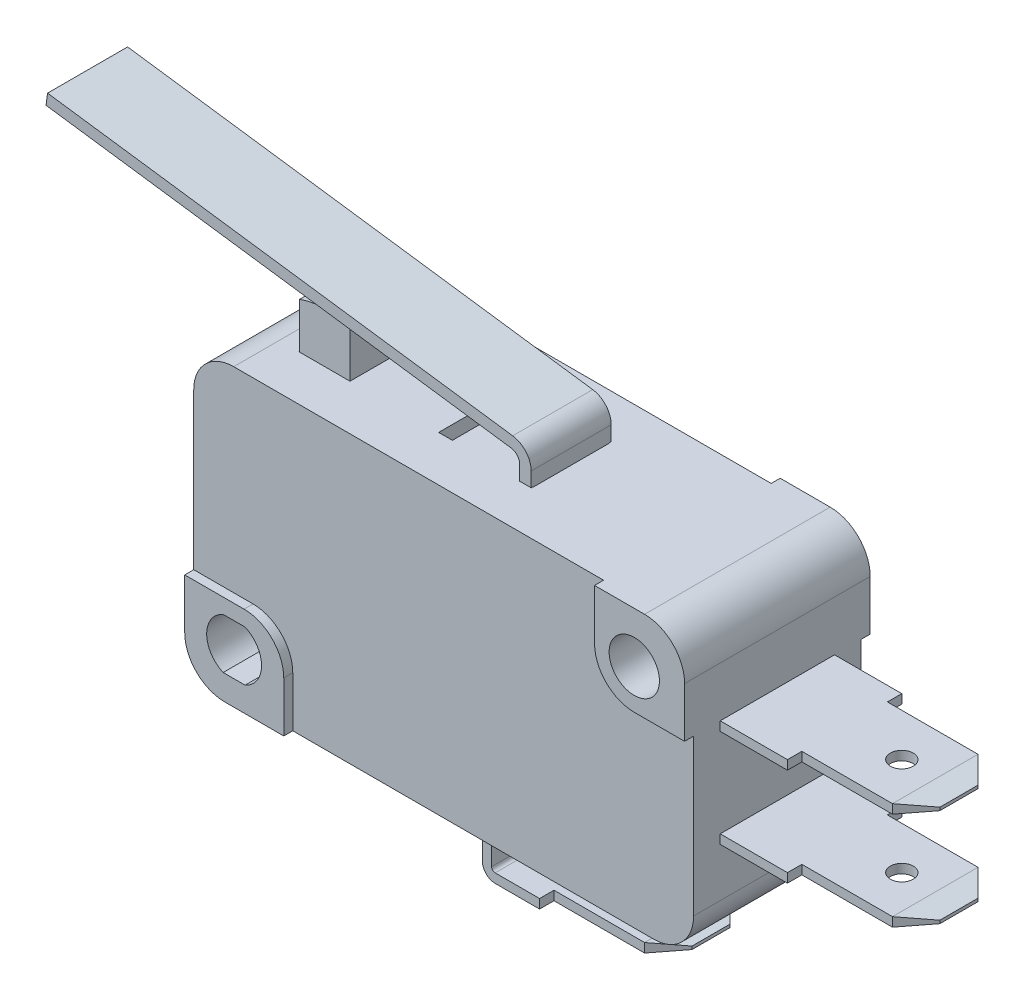
from build123d import *

# Parameters (mm, degrees)
SKETCH1_W               = 27.7622
SKETCH1_H               = 15.875
SKETCH1_R               = 1.397
EXTRUDE1_DEPTH          = 5.155
FILLET1_R               = 2.2225
EXTRUDE2_DEPTH          = 2.1
SKETCH3_W               = 2.8508
SKETCH3_H               = 4.2508
SKETCH3_W_2             = 0.762
CUT_EXTRUDE1_DEPTH      = 2
CUT_EXTRUDE2_DEPTH      = 0.5
EXTRUDE3_DEPTH          = 3.175
SKETCH6_R               = 0.635
CUT_EXTRUDE3_DEPTH      = 26.970827061
EXTRUDE4_START          = -5.0038
SKETCH8_R               = 0.635
EXTRUDE4_DEPTH          = 0.508
LPATTERN1_COUNT         = 2
LPATTERN1_PITCH         = 5.4356
CUT_EXTRUDE4_DEPTH      = 27.924770629
CUT_EXTRUDE4_DEPTH_BACK = 27.924770629
LEVER2A_START           = -2.2225
LEVER2A_DEPTH           = 4.445


# Read off the part's stored shape, not the designer's step: Lever2a
with BuildPart() as part:
    # Sketch1 → Extrude1 (new, symmetric)
    with BuildSketch(Plane.XY):
        Rectangle(SKETCH1_W, SKETCH1_H)
        with Locations((11.0871, 5.1435)):
            Circle(SKETCH1_R, mode=Mode.SUBTRACT)
        with BuildLine():
            Line((-11.746970603, -3.7719), (-10.528829397, -3.7719))
            ThreePointArc((-10.528829397, -3.7719), (-9.6139, -5.1689), (-10.528829397, -6.5659))
            Line((-10.528829397, -6.5659), (-11.746970603, -6.5659))
            ThreePointArc((-11.746970603, -6.5659), (-12.6619, -5.1689), (-11.746970603, -3.7719))
        make_face(mode=Mode.SUBTRACT)
    extrude(amount=EXTRUDE1_DEPTH, both=True)

    # Fillet1
    fillet1_edges = [part.edges().sort_by_distance(p)[0] for p in [
        (-13.8811, 7.9375, 0),
        (13.8811, 7.9375, 0),
        (13.8811, -7.9375, 0),
        (-13.8811, -7.9375, 0),
    ]]
    fillet(fillet1_edges, radius=FILLET1_R)

    # Sketch3 → Cut-Extrude1 (cut)
    with BuildSketch(Plane(origin=(0, 7.9375, 0), x_dir=(-1, 0, 0), z_dir=(0, 1, 0))):
        with Locations((9.1567, 0)):
            Rectangle(SKETCH3_W, SKETCH3_H)
        with Locations((2.4257, 0)):
            Rectangle(SKETCH3_W_2, SKETCH3_H)
        with Locations((-2.0701, 0)):
            Rectangle(SKETCH3_W_2, SKETCH3_H)
    extrude(amount=-CUT_EXTRUDE1_DEPTH, mode=Mode.SUBTRACT)

    # Sketch4 → Cut-Extrude2 (cut)
    with BuildSketch(Plane.XY.offset(5.155)):
        with BuildLine():
            Line((-8.3811, -7.9375), (13.8811, -7.9375))
            Line((13.8811, -7.9375), (13.8811, 2.9375))
            Line((13.8811, 2.9375), (11.0871, 2.9375))
            ThreePointArc((11.0871, 2.9375), (9.527222441, 3.583622441), (8.8811, 5.1435))
            Line((8.8811, 5.1435), (8.8811, 7.9375))
            Line((8.8811, 7.9375), (-13.8811, 7.9375))
            Line((-13.8811, 7.9375), (-13.8811, -2.9375))
            Line((-13.8811, -2.9375), (-10.5871, -2.9375))
            ThreePointArc((-10.5871, -2.9375), (-9.027222441, -3.583622441), (-8.3811, -5.1435))
            Line((-8.3811, -5.1435), (-8.3811, -7.9375))
        make_face()
    cut_extrude2 = extrude(amount=-CUT_EXTRUDE2_DEPTH, mode=Mode.SUBTRACT)

    # Mirror1: Cut-Extrude2 across plane
    add(cut_extrude2.mirror(Plane.XY), mode=Mode.SUBTRACT)

    # Sketch5 → Extrude3 (add, symmetric)
    with BuildSketch(Plane.XY):
        with BuildLine():
            Line((0.6731, -7.9375), (0.6731, -10.4299))
            ThreePointArc((0.6731, -10.4299), (0.880468399, -10.930531601), (1.3811, -11.1379))
            Line((1.3811, -11.1379), (10.1981, -11.1379))
            Line((10.1981, -11.1379), (10.1981, -10.6299))
            Line((10.1981, -10.6299), (1.3811, -10.6299))
            ThreePointArc((1.3811, -10.6299), (1.239678644, -10.571321356), (1.1811, -10.4299))
            Line((1.1811, -10.4299), (1.1811, -7.9375))
            Line((1.1811, -7.9375), (0.6731, -7.9375))
        make_face()
    extrude(amount=EXTRUDE3_DEPTH, both=True)

    # Sketch6 → Cut-Extrude3 (cut, through all)
    with BuildSketch(Plane(origin=(0, -10.6299, 0), x_dir=(-1, 0, 0), z_dir=(0, 1, 0))):
        with Locations((-7.0231, 0)):
            Circle(SKETCH6_R)
        Polygon((-10.1981, 1.058333333), (-8.881533333, 2.3749), (-3.8481, 2.3749), (-3.8481, 3.175), (-10.1981, 3.175), align=None)
        Polygon((-10.1981, -3.175), (-10.1981, -1.058333333), (-8.881533333, -2.3749), (-3.8481, -2.3749), (-3.8481, -3.175), align=None)
    extrude(amount=-CUT_EXTRUDE3_DEPTH, mode=Mode.SUBTRACT)

    # Sketch8 → Extrude4 (add)
    with BuildSketch(Plane(origin=(0, 7.9375, 0), x_dir=(-1, 0, 0), z_dir=(0, 1, 0)).offset(EXTRUDE4_START)):
        Polygon((-13.8811, -3.175), (-17.6149, -3.175), (-17.6149, -2.3749), (-22.648333333, -2.3749), (-23.9649, -1.058333333), (-23.9649, 1.058333333), (-22.648333333, 2.3749), (-17.6149, 2.3749), (-17.6149, 3.175), (-13.8811, 3.175), align=None)
        with Locations((-20.7899, 0)):
            Circle(SKETCH8_R, mode=Mode.SUBTRACT)
    extrude4 = extrude(amount=-EXTRUDE4_DEPTH)

    # LPattern1: Extrude4 ×2
    with Locations(*[(0, -i * LPATTERN1_PITCH, 0) for i in range(1, LPATTERN1_COUNT)]):
        add(extrude4)

    # Sketch7 → Cut-Extrude4 (cut, two sides: drawn at the far end of the back side and taken through both)
    with BuildSketch(Plane.XY.offset(-CUT_EXTRUDE4_DEPTH_BACK)):
        Polygon((8.881533333, -10.6299), (10.1981, -10.6299), (10.1981, -10.799233333), align=None)
        Polygon((8.881533333, -11.1379), (10.1981, -11.1379), (10.1981, -10.968566667), align=None)
        Polygon((22.648333333, 2.9337), (23.9649, 2.764366667), (23.9649, 2.9337), align=None)
        Polygon((23.9649, 2.595033333), (22.648333333, 2.4257), (23.9649, 2.4257), align=None)
        Polygon((22.648333333, -2.5019), (23.9649, -2.5019), (23.9649, -2.671233333), align=None)
        Polygon((23.9649, -2.840566667), (22.648333333, -3.0099), (23.9649, -3.0099), align=None)
    extrude(amount=CUT_EXTRUDE4_DEPTH + CUT_EXTRUDE4_DEPTH_BACK, mode=Mode.SUBTRACT)


with BuildPart() as body_2:
    # Sketch2 → Extrude2 (new, symmetric)
    with BuildSketch(Plane.XY):
        with BuildLine():
            Line((-10.5567, 7.278098799), (-10.5567, 10.453098799))
            ThreePointArc((-10.5567, 10.453098799), (-9.1567, 10.7061), (-7.7567, 10.453098799))
            Line((-7.7567, 10.453098799), (-7.7567, 7.278098799))
            Line((-7.7567, 7.278098799), (-10.5567, 7.278098799))
        make_face()
    extrude(amount=EXTRUDE2_DEPTH, both=True)


with BuildPart() as body_3:
    # Lever2a outline → Lever2a (new body)
    with BuildSketch(Plane.XY.offset(LEVER2A_START)):
        with BuildLine():
            Line((1.793875, 7.271748799), (2.428875, 7.271748799))
            Line((2.428875, 7.271748799), (2.428875, 8.747069475))
            ThreePointArc((2.428875, 8.747069475), (2.135886533, 9.529269286), (1.401118075, 9.926502339))
            Line((1.401118075, 9.926502339), (-24.431625, 13.49375))
            Line((-24.431625, 13.49375), (-24.518487973, 12.864719139))
            Line((-24.518487973, 12.864719139), (1.314255101, 9.297471479))
            ThreePointArc((1.314255101, 9.297471479), (1.657147049, 9.112096054), (1.793875, 8.747069475))
            Line((1.793875, 8.747069475), (1.793875, 7.271748799))
        make_face()
    extrude(amount=LEVER2A_DEPTH)


solid = Compound([part.part, body_2.part, body_3.part])
